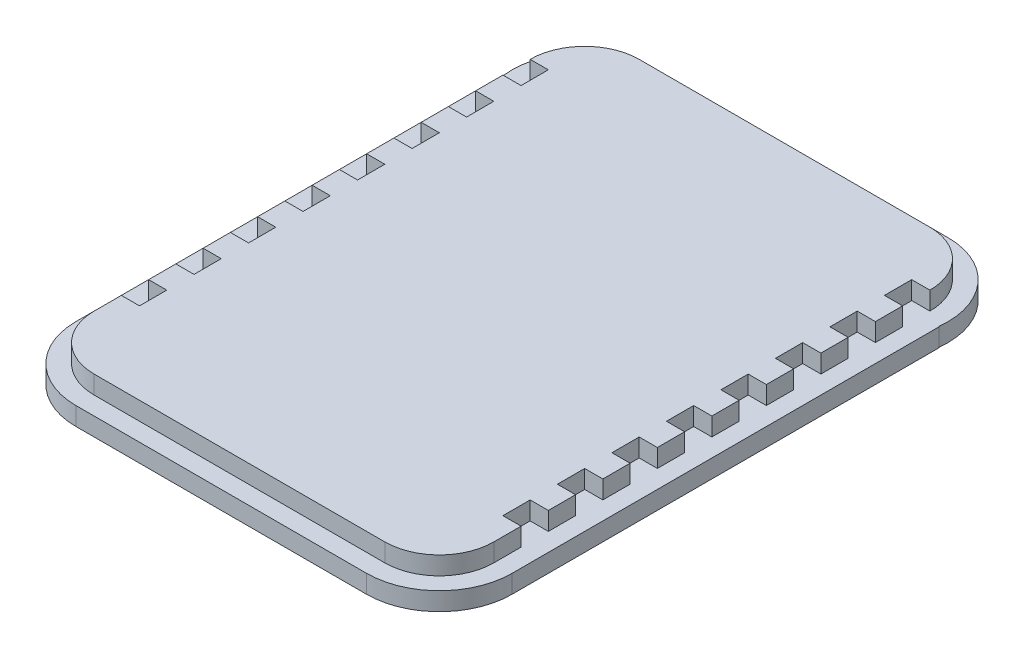
from build123d import *

# Parameters (mm, degrees)
SKETCH1_W           = 220
SKETCH1_H           = 300
BOSS_EXTRUDE1_DEPTH = 10
FILLET1_R           = 30
SKETCH9_W           = 15
SKETCH9_H           = 10
CUT_EXTRUDE1_DEPTH  = 10
SKETCH8_W           = 15
SKETCH8_H           = 10
CUT_EXTRUDE2_DEPTH  = 10
BOSS_EXTRUDE3_DEPTH = 10


with BuildPart() as part:
    # Sketch1 → Boss-Extrude1 (new body)
    with BuildSketch(Plane(origin=(0, 0, 0), x_dir=(1, 0, 0), z_dir=(0, 1, 0))):
        with Locations((110, 150)):
            Rectangle(SKETCH1_W, SKETCH1_H)
    extrude(amount=BOSS_EXTRUDE1_DEPTH)

    # Fillet1
    fillet1_edges = [part.edges().sort_by_distance(p)[0] for p in [
        (0, 5, 0),
        (220, 5, 0),
        (220, 5, -300),
        (0, 5, -300),
    ]]
    fillet(fillet1_edges, radius=FILLET1_R)

    # Sketch9 → Cut-Extrude1 (cut)
    with BuildSketch(Plane(origin=(220, 0, 0), x_dir=(0, 0, -1), z_dir=(1, 0, 0))):
        with Locations((52.5, 5)):
            Rectangle(SKETCH9_W, SKETCH9_H)
        with Locations((82.5, 5)):
            Rectangle(SKETCH9_W, SKETCH9_H)
        with Locations((112.5, 5)):
            Rectangle(SKETCH9_W, SKETCH9_H)
        with Locations((142.5, 5)):
            Rectangle(SKETCH9_W, SKETCH9_H)
        with Locations((172.5, 5)):
            Rectangle(SKETCH9_W, SKETCH9_H)
        with Locations((202.5, 5)):
            Rectangle(SKETCH9_W, SKETCH9_H)
        with Locations((232.5, 5)):
            Rectangle(SKETCH9_W, SKETCH9_H)
        with Locations((262.5, 5)):
            Rectangle(SKETCH9_W, SKETCH9_H)
    extrude(amount=-CUT_EXTRUDE1_DEPTH, mode=Mode.SUBTRACT)

    # Sketch8 → Cut-Extrude2 (cut)
    with BuildSketch(Plane.ZY):
        with Locations((-262.5, 5)):
            Rectangle(SKETCH8_W, SKETCH8_H)
        with Locations((-232.5, 5)):
            Rectangle(SKETCH8_W, SKETCH8_H)
        with Locations((-202.5, 5)):
            Rectangle(SKETCH8_W, SKETCH8_H)
        with Locations((-172.5, 5)):
            Rectangle(SKETCH8_W, SKETCH8_H)
        with Locations((-142.5, 5)):
            Rectangle(SKETCH8_W, SKETCH8_H)
        with Locations((-112.5, 5)):
            Rectangle(SKETCH8_W, SKETCH8_H)
        with Locations((-82.5, 5)):
            Rectangle(SKETCH8_W, SKETCH8_H)
        with Locations((-52.5, 5)):
            Rectangle(SKETCH8_W, SKETCH8_H)
    extrude(amount=-CUT_EXTRUDE2_DEPTH, mode=Mode.SUBTRACT)

    # Sketch11 → Boss-Extrude3 (add)
    with BuildSketch(Plane.XZ):
        with BuildLine():
            Line((30, -310), (190, -310))
            ThreePointArc((190, -310), (220, -296.457513111), (229.686269666, -265))
            Line((229.686269666, -265), (230, -265))
            Line((230, -265), (230, -30))
            ThreePointArc((230, -30), (218.284271247, -1.715728753), (190, 10))
            Line((190, 10), (30, 10))
            ThreePointArc((30, 10), (1.715728753, -1.715728753), (-10, -30))
            Line((-10, -30), (-10, -265))
            Line((-10, -265), (-9.686269666, -265))
            ThreePointArc((-9.686269666, -265), (0, -296.457513111), (30, -310))
        make_face()
    extrude(amount=BOSS_EXTRUDE3_DEPTH)


solid = part.part
